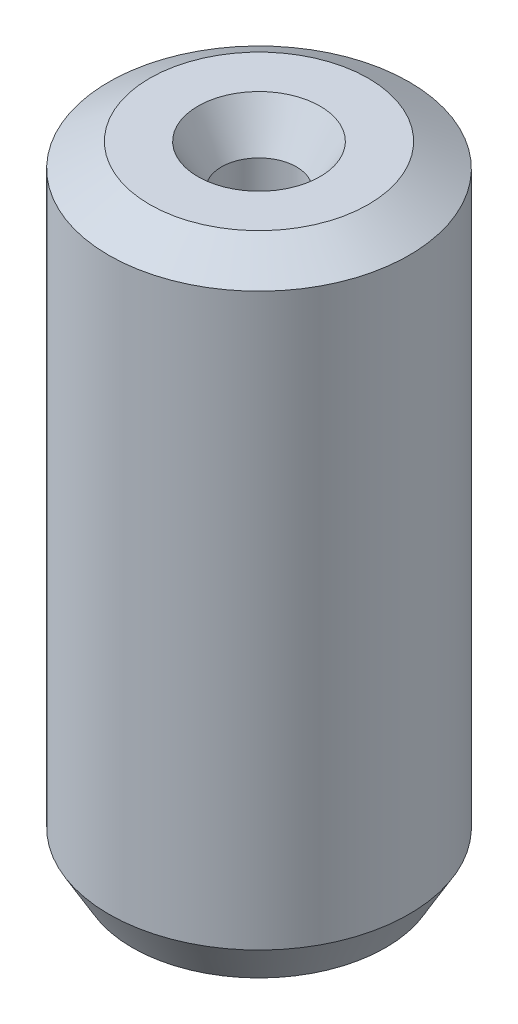
from build123d import *
from OCP.BRepFilletAPI import BRepFilletAPI_MakeChamfer

# Parameters (mm, degrees)
SKETCH1_R           = 5
BOSS_EXTRUDE1_DEPTH = 21.140414716
SKETCH2_R           = 1.249479663
CUT_EXTRUDE1_DEPTH  = 23.291638216
CHAMFER1_SIZE       = 0.784696514
CHAMFER1_SIZE2      = 1.359134231


with BuildPart() as part:
    # Sketch1 → Boss-Extrude1 (new body)
    with BuildSketch(Plane(origin=(0, 0, 0), x_dir=(1, 0, 0), z_dir=(0, 1, 0))):
        Circle(SKETCH1_R)
    extrude(amount=BOSS_EXTRUDE1_DEPTH)

    # Sketch2 → Cut-Extrude1 (cut, through all)
    with BuildSketch(Plane(origin=(0, 0, 0), x_dir=(1, 0, 0), z_dir=(0, 1, 0))):
        Circle(SKETCH2_R)
    extrude(amount=CUT_EXTRUDE1_DEPTH, mode=Mode.SUBTRACT)

    # Chamfer1: one chamfer whose edges measure the first distance from different faces: ONE call of the kernel's chamfer builder (chamfer() names one face for all edges)
    chamfer1_edges_1 = [part.edges().sort_by_distance(p)[0] for p in [
        (-1.249479663, 21.140414716, 0),
    ]]
    chamfer1_side_1 = [part.faces().sort_by_distance(p)[0] for p in [
        (-4.858578644, 21.140414716, 0),
    ]]
    chamfer1_edges_2 = [part.edges().sort_by_distance(p)[0] for p in [
        (-1.249479663, 0, 0),
    ]]
    chamfer1_side_2 = [part.faces().sort_by_distance(p)[0] for p in [
        (-1.249479663, 10.570207358, 0),
    ]]
    chamfer1_edges_3 = [part.edges().sort_by_distance(p)[0] for p in [
        (-5, 0, 0),
    ]]
    chamfer1_side_3 = [part.faces().sort_by_distance(p)[0] for p in [
        (-4.858578644, 0, 0),
    ]]
    chamfer1_edges_4 = [part.edges().sort_by_distance(p)[0] for p in [
        (-5, 21.140414716, 0),
    ]]
    chamfer1_side_4 = [part.faces().sort_by_distance(p)[0] for p in [
        (-5, 10.570207358, 0),
    ]]
    chamfer1 = BRepFilletAPI_MakeChamfer(part.part.solid().wrapped)
    for e in chamfer1_edges_1:
        chamfer1.Add(CHAMFER1_SIZE, CHAMFER1_SIZE2, e.wrapped, chamfer1_side_1[0].wrapped)  # the first distance lies on this face
    for e in chamfer1_edges_2:
        chamfer1.Add(CHAMFER1_SIZE, CHAMFER1_SIZE2, e.wrapped, chamfer1_side_2[0].wrapped)  # the first distance lies on this face
    for e in chamfer1_edges_3:
        chamfer1.Add(CHAMFER1_SIZE, CHAMFER1_SIZE2, e.wrapped, chamfer1_side_3[0].wrapped)  # the first distance lies on this face
    for e in chamfer1_edges_4:
        chamfer1.Add(CHAMFER1_SIZE, CHAMFER1_SIZE2, e.wrapped, chamfer1_side_4[0].wrapped)  # the first distance lies on this face
    add(Compound.cast(chamfer1.Shape()), mode=Mode.REPLACE)


solid = part.part
